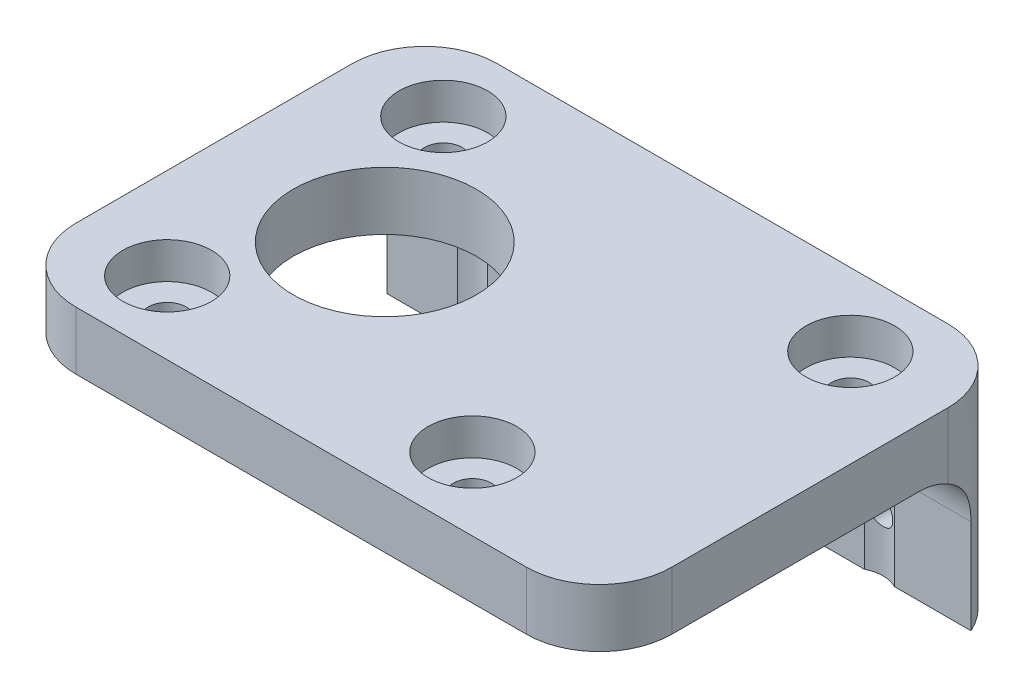
from build123d import *

# Parameters (mm, degrees)
SKETCH1_W           = 82
SKETCH1_H           = 58
SKETCH1_R           = 12.6
SKETCH1_R_2         = 6.1
BOSS_EXTRUDE1_DEPTH = 5
SKETCH2_W           = 82
SKETCH2_H           = 58
SKETCH2_R           = 2.6
SKETCH2_R_2         = 12.6
BOSS_EXTRUDE3_DEPTH = 3
SKETCH3_W           = 82
SKETCH3_H           = 6
BOSS_EXTRUDE4_DEPTH = 21
FILLET7_R           = 5
SKETCH6_R           = 4.5
CUT_EXTRUDE1_DEPTH  = 103.610915679
SKETCH9_W           = 82
SKETCH9_H           = 6
BOSS_EXTRUDE6_DEPTH = 21
FILLET9_R           = 8
SKETCH11_R          = 4.5
CUT_EXTRUDE3_DEPTH  = 103.610915699
SKETCH12_W          = 82
SKETCH12_H          = 11
CUT_EXTRUDE4_DEPTH  = 103.610915699
SKETCH13_W          = 82
SKETCH13_H          = 58
CUT_EXTRUDE5_DEPTH  = 29
SKETCH14_W          = 82
SKETCH14_H          = 6
BOSS_EXTRUDE7_DEPTH = 21
FILLET10_R          = 8
SKETCH15_R          = 4.5
CUT_EXTRUDE6_DEPTH  = 103.610915699
SKETCH16_W          = 82
SKETCH16_H          = 14
CUT_EXTRUDE7_DEPTH  = 103.610915699
FILLET11_R          = 10
SKETCH17_R          = 1.6
CUT_EXTRUDE8_DEPTH  = 105.541857752


with BuildPart() as part:
    # Sketch1 → Boss-Extrude1 (new body)
    with BuildSketch(Plane(origin=(0, 0, 0), x_dir=(1, 0, 0), z_dir=(0, 1, 0))):
        with Locations((41, 29)):
            Rectangle(SKETCH1_W, SKETCH1_H)
        with Locations(Location((23.5, 29, 0), (0, 0, 270))):
            Circle(SKETCH1_R, mode=Mode.SUBTRACT)
        with Locations(Location((68.57, 48, 0), (0, 0, 270))):
            Circle(SKETCH1_R_2, mode=Mode.SUBTRACT)
        with Locations(Location((54.561074274, 10, 0), (0, 0, 270))):
            Circle(SKETCH1_R_2, mode=Mode.SUBTRACT)
        with Locations(Location((12.561074274, 10, 0), (0, 0, 270))):
            Circle(SKETCH1_R_2, mode=Mode.SUBTRACT)
        with Locations(Location((12.561074274, 48, 0), (0, 0, 270))):
            Circle(SKETCH1_R_2, mode=Mode.SUBTRACT)
    extrude(amount=BOSS_EXTRUDE1_DEPTH)

    # Sketch2 → Boss-Extrude3 (add)
    with BuildSketch(Plane(origin=(0, 5, 0), x_dir=(1, 0, 0), z_dir=(0, 1, 0))):
        with Locations((41, 29)):
            Rectangle(SKETCH2_W, SKETCH2_H)
        with Locations(Location((12.561074274, 48, 0), (0, 0, 270))):
            Circle(SKETCH2_R, mode=Mode.SUBTRACT)
        with Locations(Location((68.57, 48, 0), (0, 0, 270))):
            Circle(SKETCH2_R, mode=Mode.SUBTRACT)
        with Locations(Location((54.561074274, 10, 0), (0, 0, 270))):
            Circle(SKETCH2_R, mode=Mode.SUBTRACT)
        with Locations(Location((12.561074274, 10, 0), (0, 0, 270))):
            Circle(SKETCH2_R, mode=Mode.SUBTRACT)
        with Locations(Location((23.5, 29, 0), (0, 0, 270))):
            Circle(SKETCH2_R_2, mode=Mode.SUBTRACT)
    extrude(amount=BOSS_EXTRUDE3_DEPTH)

    # Sketch3 → Boss-Extrude4 (add)
    with BuildSketch(Plane(origin=(0, 8, 0), x_dir=(1, 0, 0), z_dir=(0, 1, 0))):
        with Locations((41, 55)):
            Rectangle(SKETCH3_W, SKETCH3_H)
    extrude(amount=BOSS_EXTRUDE4_DEPTH)

    # Fillet7
    # the kernel refuses this fillet: 5 mm, written as the material it adds along each edge
    with BuildSketch(Plane(origin=(82, 8, -52), x_dir=(0, 1, 0), z_dir=(-1, 0, 0))) as fillet7_piece_1_section:
        with BuildLine():
            CenterArc((FILLET7_R, -FILLET7_R), FILLET7_R, 90, 90)
            Line((0, -FILLET7_R), (0, 0))
            Line((0, 0), (FILLET7_R, 0))
        make_face()
    fillet7_piece_1 = extrude(amount=82, mode=Mode.PRIVATE)
    fillet7_piece_1 = fillet7_piece_1 - Plane(origin=(12.561074274, 9.156669845, -48), x_dir=(0, 0, 1), z_dir=(0, -1, 0)) * Cylinder(2.6, 184, mode=Mode.PRIVATE)
    fillet7_piece_1 = fillet7_piece_1 - Plane(origin=(68.57, 9.156669845, -48), x_dir=(0, 0, 1), z_dir=(0, -1, 0)) * Cylinder(2.6, 184, mode=Mode.PRIVATE)
    add(fillet7_piece_1)

    # Sketch6 → Cut-Extrude1 (cut, through all)
    with BuildSketch(Plane(origin=(0, 8, 0), x_dir=(1, 0, 0), z_dir=(0, 1, 0))):
        with Locations((12.561074274, 48)):
            Circle(SKETCH6_R)
        with Locations((68.57, 48)):
            Circle(SKETCH6_R)
    extrude(amount=CUT_EXTRUDE1_DEPTH, mode=Mode.SUBTRACT)

    # Sketch9 → Boss-Extrude6 (add)
    with BuildSketch(Plane(origin=(0, 8, 0), x_dir=(1, 0, 0), z_dir=(0, 1, 0))):
        with Locations((41, 3)):
            Rectangle(SKETCH9_W, SKETCH9_H)
    extrude(amount=BOSS_EXTRUDE6_DEPTH)

    # Fillet9
    # the kernel refuses this fillet: 8 mm, written as the material it adds along each edge
    with BuildSketch(Plane(origin=(82, 8, -6), x_dir=(0, 0, -1), z_dir=(-1, 0, 0))) as fillet9_piece_1_section:
        with BuildLine():
            CenterArc((FILLET9_R, -FILLET9_R), FILLET9_R, 90, 90)
            Line((0, -FILLET9_R), (0, 0))
            Line((0, 0), (FILLET9_R, 0))
        make_face()
    fillet9_piece_1 = extrude(amount=82, mode=Mode.PRIVATE)
    fillet9_piece_1 = fillet9_piece_1 - Plane(origin=(12.561074274, 9.859424817, -10), x_dir=(0, 0, 1), z_dir=(0, -1, 0)) * Cylinder(2.6, 196, mode=Mode.PRIVATE)
    fillet9_piece_1 = fillet9_piece_1 - Plane(origin=(54.561074274, 9.859424817, -10), x_dir=(0, 0, 1), z_dir=(0, -1, 0)) * Cylinder(2.6, 196, mode=Mode.PRIVATE)
    add(fillet9_piece_1)

    # Sketch11 → Cut-Extrude3 (cut, through all)
    with BuildSketch(Plane(origin=(0, 8, 0), x_dir=(1, 0, 0), z_dir=(0, 1, 0))):
        with Locations((12.561074274, 10)):
            Circle(SKETCH11_R)
        with Locations((54.561074274, 10)):
            Circle(SKETCH11_R)
    extrude(amount=CUT_EXTRUDE3_DEPTH, mode=Mode.SUBTRACT)

    # Sketch12 → Cut-Extrude4 (cut, through all)
    with BuildSketch(Plane(origin=(0, 8, 0), x_dir=(1, 0, 0), z_dir=(0, 1, 0))):
        with Locations((41, 52.5)):
            Rectangle(SKETCH12_W, SKETCH12_H)
    extrude(amount=CUT_EXTRUDE4_DEPTH, mode=Mode.SUBTRACT)

    # Mirror1: part across plane


with BuildPart() as part_1:
    add(part.part)
    add(part.part.mirror(Plane.ZX))

    # Sketch13 → Cut-Extrude5 (cut)
    with BuildSketch(Plane(origin=(0, 29, 0), x_dir=(1, 0, 0), z_dir=(0, 1, 0))):
        with Locations((41, 29)):
            Rectangle(SKETCH13_W, SKETCH13_H)
    extrude(amount=-CUT_EXTRUDE5_DEPTH, mode=Mode.SUBTRACT)

    # Sketch14 → Boss-Extrude7 (add)
    with BuildSketch(Plane.XZ.offset(8)):
        with Locations((41, -55)):
            Rectangle(SKETCH14_W, SKETCH14_H)
    extrude(amount=BOSS_EXTRUDE7_DEPTH)

    # Fillet10
    # the kernel refuses this fillet: 8 mm, written as the material it adds along each edge
    with BuildSketch(Plane(origin=(82, -8, -52), x_dir=(0, -1, 0), z_dir=(-1, 0, 0))) as fillet10_piece_1_section:
        with BuildLine():
            CenterArc((FILLET10_R, FILLET10_R), FILLET10_R, 180, 90)
            Line((0, FILLET10_R), (0, 0))
            Line((0, 0), (FILLET10_R, 0))
        make_face()
    fillet10_piece_1 = extrude(amount=82, mode=Mode.PRIVATE)
    fillet10_piece_1 = fillet10_piece_1 - Plane(origin=(12.561074274, -9.859451405, -48), x_dir=(0, 0, 1), z_dir=(0, 1, 0)) * Cylinder(2.6, 196, mode=Mode.PRIVATE)
    fillet10_piece_1 = fillet10_piece_1 - Plane(origin=(68.57, -9.859451405, -48), x_dir=(0, 0, 1), z_dir=(0, 1, 0)) * Cylinder(2.6, 196, mode=Mode.PRIVATE)
    add(fillet10_piece_1)

    # Sketch15 → Cut-Extrude6 (cut, through all)
    with BuildSketch(Plane.XZ.offset(8)):
        with Locations((12.561074274, -48)):
            Circle(SKETCH15_R)
        with Locations((68.57, -48)):
            Circle(SKETCH15_R)
    extrude(amount=CUT_EXTRUDE6_DEPTH, mode=Mode.SUBTRACT)

    # Sketch16 → Cut-Extrude7 (cut, through all)
    with BuildSketch(Plane.XZ.offset(8)):
        with Locations((41, -7)):
            Rectangle(SKETCH16_W, SKETCH16_H)
    extrude(amount=CUT_EXTRUDE7_DEPTH, mode=Mode.SUBTRACT)

    # Fillet11
    fillet11_edges = [part_1.edges().sort_by_distance(p)[0] for p in [
        (82, -14.5, -58),
        (0, -14.5, -58),
        (0, -4, 0),
        (82, -4, 0),
    ]]
    fillet(fillet11_edges, radius=FILLET11_R)

    # Sketch17 → Cut-Extrude8 (cut, through all)
    with BuildSketch(Plane(origin=(0, 0, -58), x_dir=(-1, 0, 0), z_dir=(0, 0, -1))):
        with Locations((-23.6, -21.5)):
            Circle(SKETCH17_R)
        with Locations((-68.6, -21.5)):
            Circle(SKETCH17_R)
    extrude(amount=-CUT_EXTRUDE8_DEPTH, mode=Mode.SUBTRACT)


solid = part_1.part
